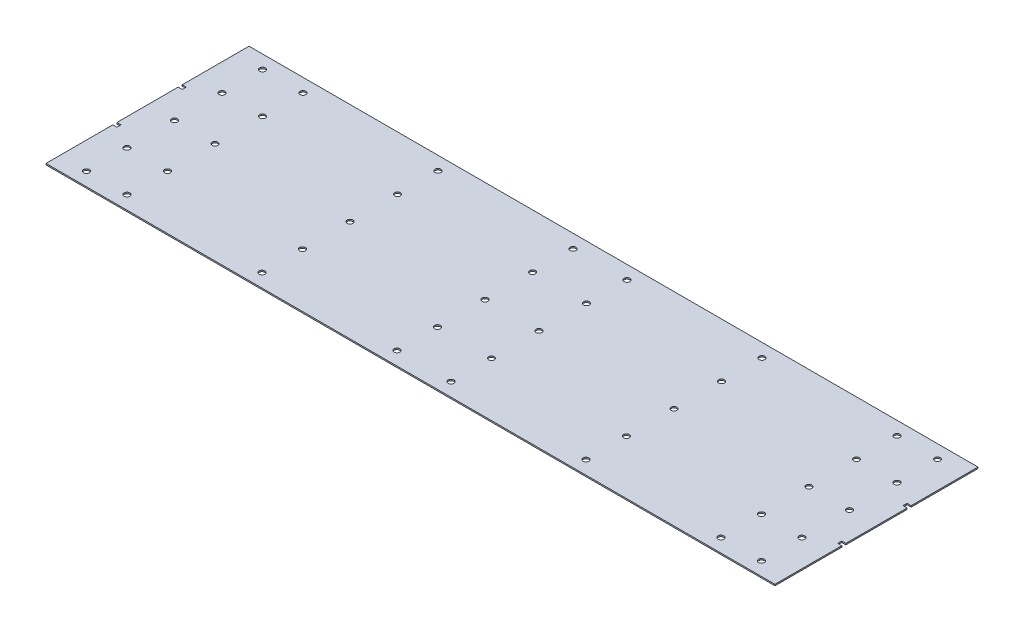
from build123d import *

# Parameters (mm, degrees)
SKETCH1_R           = 2.15
BOSS_EXTRUDE1_DEPTH = 1


with BuildPart() as part:
    # Sketch1 → Boss-Extrude1 (new body)
    with BuildSketch(Plane(origin=(0, 0, 0), x_dir=(1, 0, 0), z_dir=(0, 1, 0))):
        Polygon((-247, -25.7), (-250, -25.7), (-250, -75.2), (290, -75.2), (290, -25.7), (287, -25.7), (287, -22.7), (290, -22.7), (290, 22.7), (287, 22.7), (287, 25.7), (290, 25.7), (290, 75.2), (-250, 75.2), (-250, 25.7), (-247, 25.7), (-247, 22.7), (-250, 22.7), (-250, -22.7), (-247, -22.7), align=None)
        with Locations((-230, -65.2)):
            Circle(SKETCH1_R, mode=Mode.SUBTRACT)
        with Locations((-200, -65.2)):
            Circle(SKETCH1_R, mode=Mode.SUBTRACT)
        with Locations((-100, -65.2)):
            Circle(SKETCH1_R, mode=Mode.SUBTRACT)
        with Locations((0, -65.2)):
            Circle(SKETCH1_R, mode=Mode.SUBTRACT)
        with Locations((-230, -35.2)):
            Circle(SKETCH1_R, mode=Mode.SUBTRACT)
        with Locations((-200, -35.2)):
            Circle(SKETCH1_R, mode=Mode.SUBTRACT)
        with Locations((-230, 0)):
            Circle(SKETCH1_R, mode=Mode.SUBTRACT)
        with Locations((-200, 0)):
            Circle(SKETCH1_R, mode=Mode.SUBTRACT)
        with Locations((-100, -35.2)):
            Circle(SKETCH1_R, mode=Mode.SUBTRACT)
        with Locations((0, -35.2)):
            Circle(SKETCH1_R, mode=Mode.SUBTRACT)
        with Locations((-100, 0)):
            Circle(SKETCH1_R, mode=Mode.SUBTRACT)
        Circle(SKETCH1_R, mode=Mode.SUBTRACT)
        with Locations((40, -65.2)):
            Circle(SKETCH1_R, mode=Mode.SUBTRACT)
        with Locations((140, -65.2)):
            Circle(SKETCH1_R, mode=Mode.SUBTRACT)
        with Locations((240, -65.2)):
            Circle(SKETCH1_R, mode=Mode.SUBTRACT)
        with Locations((270, -65.2)):
            Circle(SKETCH1_R, mode=Mode.SUBTRACT)
        with Locations((40, -35.2)):
            Circle(SKETCH1_R, mode=Mode.SUBTRACT)
        with Locations((140, -35.2)):
            Circle(SKETCH1_R, mode=Mode.SUBTRACT)
        with Locations((40, 0)):
            Circle(SKETCH1_R, mode=Mode.SUBTRACT)
        with Locations((140, 0)):
            Circle(SKETCH1_R, mode=Mode.SUBTRACT)
        with Locations((240, -35.2)):
            Circle(SKETCH1_R, mode=Mode.SUBTRACT)
        with Locations((270, -35.2)):
            Circle(SKETCH1_R, mode=Mode.SUBTRACT)
        with Locations((240, 0)):
            Circle(SKETCH1_R, mode=Mode.SUBTRACT)
        with Locations((270, 0)):
            Circle(SKETCH1_R, mode=Mode.SUBTRACT)
        with Locations((-230, 35.2)):
            Circle(SKETCH1_R, mode=Mode.SUBTRACT)
        with Locations((-200, 35.2)):
            Circle(SKETCH1_R, mode=Mode.SUBTRACT)
        with Locations((-100, 35.2)):
            Circle(SKETCH1_R, mode=Mode.SUBTRACT)
        with Locations((0, 35.2)):
            Circle(SKETCH1_R, mode=Mode.SUBTRACT)
        with Locations((-230, 65.2)):
            Circle(SKETCH1_R, mode=Mode.SUBTRACT)
        with Locations((-200, 65.2)):
            Circle(SKETCH1_R, mode=Mode.SUBTRACT)
        with Locations((-100, 65.2)):
            Circle(SKETCH1_R, mode=Mode.SUBTRACT)
        with Locations((0, 65.2)):
            Circle(SKETCH1_R, mode=Mode.SUBTRACT)
        with Locations((40, 35.2)):
            Circle(SKETCH1_R, mode=Mode.SUBTRACT)
        with Locations((140, 35.2)):
            Circle(SKETCH1_R, mode=Mode.SUBTRACT)
        with Locations((240, 35.2)):
            Circle(SKETCH1_R, mode=Mode.SUBTRACT)
        with Locations((270, 35.2)):
            Circle(SKETCH1_R, mode=Mode.SUBTRACT)
        with Locations((40, 65.2)):
            Circle(SKETCH1_R, mode=Mode.SUBTRACT)
        with Locations((140, 65.2)):
            Circle(SKETCH1_R, mode=Mode.SUBTRACT)
        with Locations((240, 65.2)):
            Circle(SKETCH1_R, mode=Mode.SUBTRACT)
        with Locations((270, 65.2)):
            Circle(SKETCH1_R, mode=Mode.SUBTRACT)
    extrude(amount=BOSS_EXTRUDE1_DEPTH)


solid = part.part
